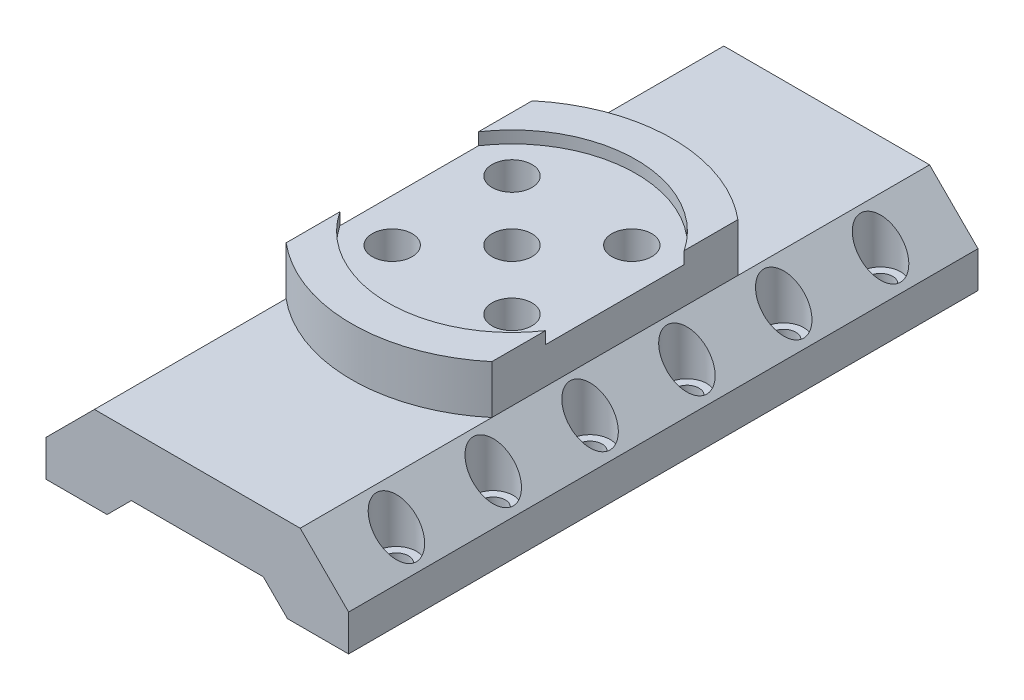
from build123d import *

# Parameters (mm, degrees)
SKETCH1_W           = 25
SKETCH1_H           = 52
BOSS_EXTRUDE1_DEPTH = 7
SKETCH2_R           = 1
CUT_EXTRUDE1_DEPTH  = 30.685855218
LPATTERN1_COUNT     = 6
LPATTERN1_PITCH     = 8
CHAMFER2_SIZE       = 4
SKETCH10_W          = 14.9
SKETCH10_H          = 52
CUT_EXTRUDE4_DEPTH  = 2
CHAMFER3_SIZE       = 2
BOSS_EXTRUDE2_DEPTH = 3
BOSS_EXTRUDE3_DEPTH = 4
SKETCH13_R          = 1.65
CUT_EXTRUDE5_DEPTH  = 3
CUT_EXTRUDE6_REACH  = 31.686
SKETCH14_R          = 3
SKETCH16_R          = 1.65
CUT_EXTRUDE7_DEPTH  = 4.5


# Some blends are built 0.0001 mm under size
with BuildPart() as part:
    # Sketch1 → Boss-Extrude1 (new body)
    with BuildSketch(Plane(origin=(0, 0, 0), x_dir=(1, 0, 0), z_dir=(0, 1, 0))):
        Rectangle(SKETCH1_W, SKETCH1_H)
    extrude(amount=BOSS_EXTRUDE1_DEPTH)

    # Sketch2 → Cut-Extrude1 (cut, through all)
    with BuildSketch(Plane(origin=(0, 7, 0), x_dir=(1, 0, 0), z_dir=(0, 1, 0))):
        with Locations(Location((-10.45, -20, 0), (0, 0, 270))):
            Circle(SKETCH2_R)
        with Locations(Location((10.45, -20, 0), (0, 0, 270))):
            Circle(SKETCH2_R)
    cut_extrude1 = extrude(amount=-CUT_EXTRUDE1_DEPTH, mode=Mode.SUBTRACT)

    # LPattern1: Cut-Extrude1 ×6
    with Locations(*[(0, 0, -i * LPATTERN1_PITCH) for i in range(1, LPATTERN1_COUNT)]):
        add(cut_extrude1, mode=Mode.SUBTRACT)

    # Chamfer2
    # the kernel refuses this chamfer: 4 mm, written as the material it takes off along each edge
    with BuildSketch(Plane(origin=(-12.5, 7, -36.286731952), x_dir=(-0.027495876610586487, -0.9996219169112968, 0), z_dir=(0, 0, 1)), Plane(origin=(12.5, 7, 36.286731952), x_dir=(0.027495876610586487, -0.9996219169112968, 0), z_dir=(0, 0, -1))) as chamfer2_piece_1:
        Polygon((CHAMFER2_SIZE * 0.999621916911, CHAMFER2_SIZE * 0.0274958766106), (-CHAMFER2_SIZE * 0.0274958766106, CHAMFER2_SIZE * 0.999621916911), (0, 0), align=None)
    extrude(amount=72.573463904, mode=Mode.SUBTRACT)

    # Sketch10 → Cut-Extrude4 (cut)
    with BuildSketch(Plane.XZ):
        Rectangle(SKETCH10_W, SKETCH10_H)
    extrude(amount=-CUT_EXTRUDE4_DEPTH, mode=Mode.SUBTRACT)

    # Chamfer3
    chamfer3_edges = [part.edges().sort_by_distance(p)[0] for p in [
        (7.45, 2, 0),
        (-7.45, 2, 0),
    ]]
    chamfer(chamfer3_edges, length=CHAMFER3_SIZE - 0.0001)  # a hair under: the kernel refuses the full size

    # Sketch12 → Boss-Extrude2 (add)
    with BuildSketch(Plane(origin=(0, 7, 0), x_dir=(1, 0, 0), z_dir=(0, 1, 0))):
        with BuildLine():
            ThreePointArc((8.5, 5.728219619), (0, 10.25), (-8.5, 5.728219619))
            Line((-8.5, 5.728219619), (-8.5, -5.728219619))
            ThreePointArc((-8.5, -5.728219619), (0, -10.25), (8.5, -5.728219619))
            Line((8.5, -5.728219619), (8.5, 5.728219619))
        make_face()
    extrude(amount=BOSS_EXTRUDE2_DEPTH)

    # Sketch12<3> → Boss-Extrude3 (add)
    with BuildSketch(Plane(origin=(0, 7, 0), x_dir=(1, 0, 0), z_dir=(0, 1, 0))):
        with BuildLine():
            ThreePointArc((8.5, 10.164275675), (0, 13.25), (-8.5, 10.164275675))
            Line((-8.5, 10.164275675), (-8.5, 5.728219619))
            ThreePointArc((-8.5, 5.728219619), (0, 10.25), (8.5, 5.728219619))
            Line((8.5, 5.728219619), (8.5, 10.164275675))
        make_face()
        with BuildLine():
            Line((-8.5, -5.728219619), (-8.5, -10.164275675))
            ThreePointArc((-8.5, -10.164275675), (0, -13.25), (8.5, -10.164275675))
            Line((8.5, -10.164275675), (8.5, -5.728219619))
            ThreePointArc((8.5, -5.728219619), (0, -10.25), (-8.5, -5.728219619))
        make_face()
    extrude(amount=BOSS_EXTRUDE3_DEPTH)

    # Sketch13 → Cut-Extrude5 (cut)
    with BuildSketch(Plane(origin=(0, 10, 0), x_dir=(1, 0, 0), z_dir=(0, 1, 0))):
        with Locations(Location((-4.949747468, 4.949747468, 0), (0, 0, 270))):
            Circle(SKETCH13_R)
        with Locations(Location((4.949747468, 4.949747468, 0), (0, 0, 270))):
            Circle(SKETCH13_R)
        with Locations(Location((4.949747468, -4.949747468, 0), (0, 0, 270))):
            Circle(SKETCH13_R)
        with Locations(Location((-4.949747468, -4.949747468, 0), (0, 0, 270))):
            Circle(SKETCH13_R)
        with Locations(Location((0, 0, 0), (0, 0, 270))):
            Circle(SKETCH13_R)
    extrude(amount=-CUT_EXTRUDE5_DEPTH, mode=Mode.SUBTRACT)

    # Sketch14 → Cut-Extrude6 (cut, up to next)
    with BuildSketch(Plane(origin=(0, 7, 0), x_dir=(1, 0, 0), z_dir=(0, 1, 0)), mode=Mode.PRIVATE) as cut_extrude6_sk1:
        with Locations(Location((-4.949747468, 4.949747468, 0), (0, 0, 270))):
            Circle(SKETCH14_R)
    cut_extrude6_tool1 = extrude(cut_extrude6_sk1.sketch, amount=-CUT_EXTRUDE6_REACH, mode=Mode.PRIVATE) & part.part
    # Sketch14 → Cut-Extrude6 (cut, up to next)
    with BuildSketch(Plane(origin=(0, 7, 0), x_dir=(1, 0, 0), z_dir=(0, 1, 0)), mode=Mode.PRIVATE) as cut_extrude6_sk2:
        with Locations(Location((4.949747468, 4.949747468, 0), (0, 0, 270))):
            Circle(SKETCH14_R)
    cut_extrude6_tool2 = extrude(cut_extrude6_sk2.sketch, amount=-CUT_EXTRUDE6_REACH, mode=Mode.PRIVATE) & part.part
    # Sketch14 → Cut-Extrude6 (cut, up to next)
    with BuildSketch(Plane(origin=(0, 7, 0), x_dir=(1, 0, 0), z_dir=(0, 1, 0)), mode=Mode.PRIVATE) as cut_extrude6_sk3:
        with Locations(Location((4.949747468, -4.949747468, 0), (0, 0, 270))):
            Circle(SKETCH14_R)
    cut_extrude6_tool3 = extrude(cut_extrude6_sk3.sketch, amount=-CUT_EXTRUDE6_REACH, mode=Mode.PRIVATE) & part.part
    # Sketch14 → Cut-Extrude6 (cut, up to next)
    with BuildSketch(Plane(origin=(0, 7, 0), x_dir=(1, 0, 0), z_dir=(0, 1, 0)), mode=Mode.PRIVATE) as cut_extrude6_sk4:
        with Locations(Location((-4.949747468, -4.949747468, 0), (0, 0, 270))):
            Circle(SKETCH14_R)
    cut_extrude6_tool4 = extrude(cut_extrude6_sk4.sketch, amount=-CUT_EXTRUDE6_REACH, mode=Mode.PRIVATE) & part.part
    # Sketch14 → Cut-Extrude6 (cut, up to next)
    with BuildSketch(Plane(origin=(0, 7, 0), x_dir=(1, 0, 0), z_dir=(0, 1, 0)), mode=Mode.PRIVATE) as cut_extrude6_sk5:
        with Locations(Location((0, 0, 0), (0, 0, 270))):
            Circle(SKETCH14_R)
    cut_extrude6_tool5 = extrude(cut_extrude6_sk5.sketch, amount=-CUT_EXTRUDE6_REACH, mode=Mode.PRIVATE) & part.part
    add(cut_extrude6_tool1.solids().sort_by_distance((-4.949747, 7, -4.949747))[0], mode=Mode.SUBTRACT)
    add(cut_extrude6_tool2.solids().sort_by_distance((4.949747, 7, -4.949747))[0], mode=Mode.SUBTRACT)
    add(cut_extrude6_tool3.solids().sort_by_distance((4.949747, 7, 4.949747))[0], mode=Mode.SUBTRACT)
    add(cut_extrude6_tool4.solids().sort_by_distance((-4.949747, 7, 4.949747))[0], mode=Mode.SUBTRACT)
    add(cut_extrude6_tool5.solids().sort_by_distance((0, 7, 0))[0], mode=Mode.SUBTRACT)

    # Sketch16 → Cut-Extrude7 (cut)
    with BuildSketch(Plane(origin=(0, 7, 0), x_dir=(1, 0, 0), z_dir=(0, 1, 0))):
        with Locations(Location((-10.45, -20, 0), (0, 0, 270))):
            Circle(SKETCH16_R)
        with Locations(Location((10.45, -20, 0), (0, 0, 270))):
            Circle(SKETCH16_R)
        with Locations(Location((10.45, -12, 0), (0, 0, 270))):
            Circle(SKETCH16_R)
        with Locations(Location((-10.45, -12, 0), (0, 0, 270))):
            Circle(SKETCH16_R)
        with Locations(Location((10.45, -4, 0), (0, 0, 270))):
            Circle(SKETCH16_R)
        with Locations(Location((-10.45, -4, 0), (0, 0, 270))):
            Circle(SKETCH16_R)
        with Locations(Location((10.45, 4, 0), (0, 0, 270))):
            Circle(SKETCH16_R)
        with Locations(Location((-10.45, 4, 0), (0, 0, 270))):
            Circle(SKETCH16_R)
        with Locations(Location((10.45, 12, 0), (0, 0, 270))):
            Circle(SKETCH16_R)
        with Locations(Location((-10.45, 12, 0), (0, 0, 270))):
            Circle(SKETCH16_R)
        with Locations(Location((10.45, 20, 0), (0, 0, 270))):
            Circle(SKETCH16_R)
        with Locations(Location((-10.45, 20, 0), (0, 0, 270))):
            Circle(SKETCH16_R)
    extrude(amount=-CUT_EXTRUDE7_DEPTH, mode=Mode.SUBTRACT)


solid = part.part
